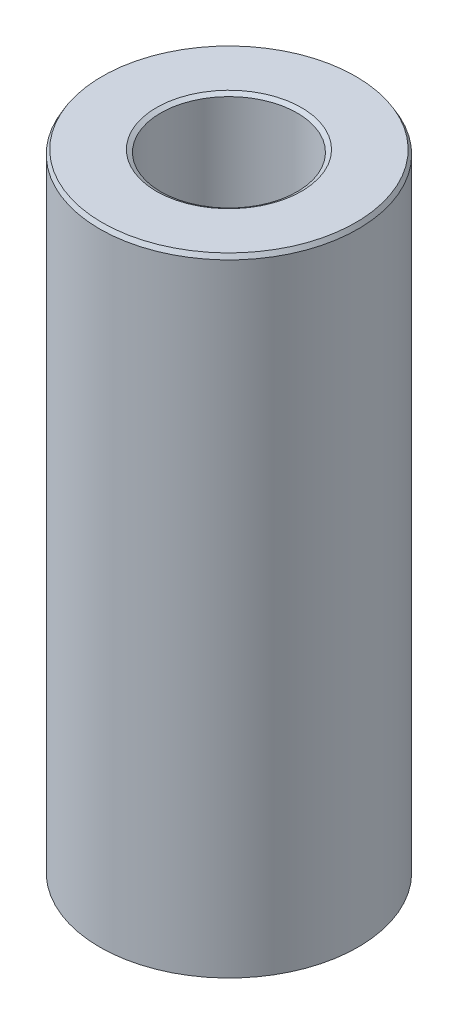
from build123d import *
from OCP.BRepFilletAPI import BRepFilletAPI_MakeChamfer

# Parameters (mm, degrees)
SKETCH1_R           = 17.5
BOSS_EXTRUDE1_DEPTH = 85.141194231
SKETCH2_R           = 9.244007726
CUT_EXTRUDE1_DEPTH  = 89.665229685
CHAMFER1_SIZE       = 0.581777545
CHAMFER1_SIZE2      = 0.335889422


with BuildPart() as part:
    # Sketch1 → Boss-Extrude1 (new body)
    with BuildSketch(Plane(origin=(0, 0, 0), x_dir=(1, 0, 0), z_dir=(0, 1, 0))):
        Circle(SKETCH1_R)
    extrude(amount=BOSS_EXTRUDE1_DEPTH)

    # Sketch2 → Cut-Extrude1 (cut, through all)
    with BuildSketch(Plane(origin=(0, 0, 0), x_dir=(1, 0, 0), z_dir=(0, 1, 0))):
        Circle(SKETCH2_R)
    extrude(amount=CUT_EXTRUDE1_DEPTH, mode=Mode.SUBTRACT)

    # Chamfer1: one chamfer whose edges measure the first distance from different faces: ONE call of the kernel's chamfer builder (chamfer() names one face for all edges)
    chamfer1_edges_1 = [part.edges().sort_by_distance(p)[0] for p in [
        (-9.244007726, 85.141194231, 0),
    ]]
    chamfer1_side_1 = [part.faces().sort_by_distance(p)[0] for p in [
        (-17.005025253, 85.141194231, 0),
    ]]
    chamfer1_edges_2 = [part.edges().sort_by_distance(p)[0] for p in [
        (-9.244007726, 0, 0),
    ]]
    chamfer1_side_2 = [part.faces().sort_by_distance(p)[0] for p in [
        (-9.244007726, 42.570597116, 0),
    ]]
    chamfer1_edges_3 = [part.edges().sort_by_distance(p)[0] for p in [
        (-17.5, 0, 0),
    ]]
    chamfer1_side_3 = [part.faces().sort_by_distance(p)[0] for p in [
        (-17.005025253, 0, 0),
    ]]
    chamfer1_edges_4 = [part.edges().sort_by_distance(p)[0] for p in [
        (-17.5, 85.141194231, 0),
    ]]
    chamfer1_side_4 = [part.faces().sort_by_distance(p)[0] for p in [
        (-17.5, 42.570597116, 0),
    ]]
    chamfer1 = BRepFilletAPI_MakeChamfer(part.part.solid().wrapped)
    for e in chamfer1_edges_1:
        chamfer1.Add(CHAMFER1_SIZE, CHAMFER1_SIZE2, e.wrapped, chamfer1_side_1[0].wrapped)  # the first distance lies on this face
    for e in chamfer1_edges_2:
        chamfer1.Add(CHAMFER1_SIZE, CHAMFER1_SIZE2, e.wrapped, chamfer1_side_2[0].wrapped)  # the first distance lies on this face
    for e in chamfer1_edges_3:
        chamfer1.Add(CHAMFER1_SIZE, CHAMFER1_SIZE2, e.wrapped, chamfer1_side_3[0].wrapped)  # the first distance lies on this face
    for e in chamfer1_edges_4:
        chamfer1.Add(CHAMFER1_SIZE, CHAMFER1_SIZE2, e.wrapped, chamfer1_side_4[0].wrapped)  # the first distance lies on this face
    add(Compound.cast(chamfer1.Shape()), mode=Mode.REPLACE)


solid = part.part
